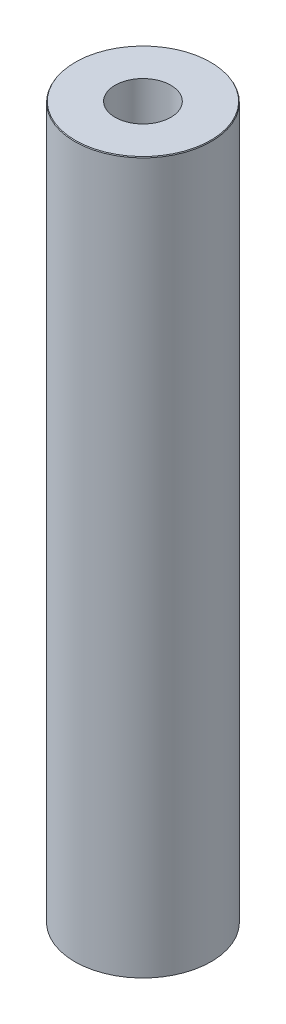
from build123d import *
from OCP.BRepFilletAPI import BRepFilletAPI_MakeChamfer

# Parameters (mm, degrees)
SKETCH1_R           = 57.5
BOSS_EXTRUDE1_DEPTH = 600
SKETCH2_R           = 23.489869468
CUT_EXTRUDE1_DEPTH  = 606.485342515
CHAMFER1_SIZE       = 0.727461538
CHAMFER1_SIZE2      = 0.420000115


with BuildPart() as part:
    # Sketch1 → Boss-Extrude1 (new body)
    with BuildSketch(Plane(origin=(0, 0, 0), x_dir=(1, 0, 0), z_dir=(0, 1, 0))):
        Circle(SKETCH1_R)
    extrude(amount=BOSS_EXTRUDE1_DEPTH)

    # Sketch2 → Cut-Extrude1 (cut, through all)
    with BuildSketch(Plane(origin=(0, 0, 0), x_dir=(1, 0, 0), z_dir=(0, 1, 0))):
        Circle(SKETCH2_R)
    extrude(amount=CUT_EXTRUDE1_DEPTH, mode=Mode.SUBTRACT)

    # Chamfer1: one chamfer whose edges measure the first distance from different faces: ONE call of the kernel's chamfer builder (chamfer() names one face for all edges)
    chamfer1_edges_1 = [part.edges().sort_by_distance(p)[0] for p in [
        (-57.5, 600, 0),
    ]]
    chamfer1_side_1 = [part.faces().sort_by_distance(p)[0] for p in [
        (-57.5, 300, 0),
    ]]
    chamfer1_edges_2 = [part.edges().sort_by_distance(p)[0] for p in [
        (-57.5, 0, 0),
    ]]
    chamfer1_side_2 = [part.faces().sort_by_distance(p)[0] for p in [
        (-55.873654403, 0, 0),
    ]]
    chamfer1 = BRepFilletAPI_MakeChamfer(part.part.solid().wrapped)
    for e in chamfer1_edges_1:
        chamfer1.Add(CHAMFER1_SIZE, CHAMFER1_SIZE2, e.wrapped, chamfer1_side_1[0].wrapped)  # the first distance lies on this face
    for e in chamfer1_edges_2:
        chamfer1.Add(CHAMFER1_SIZE, CHAMFER1_SIZE2, e.wrapped, chamfer1_side_2[0].wrapped)  # the first distance lies on this face
    add(Compound.cast(chamfer1.Shape()), mode=Mode.REPLACE)


solid = part.part
